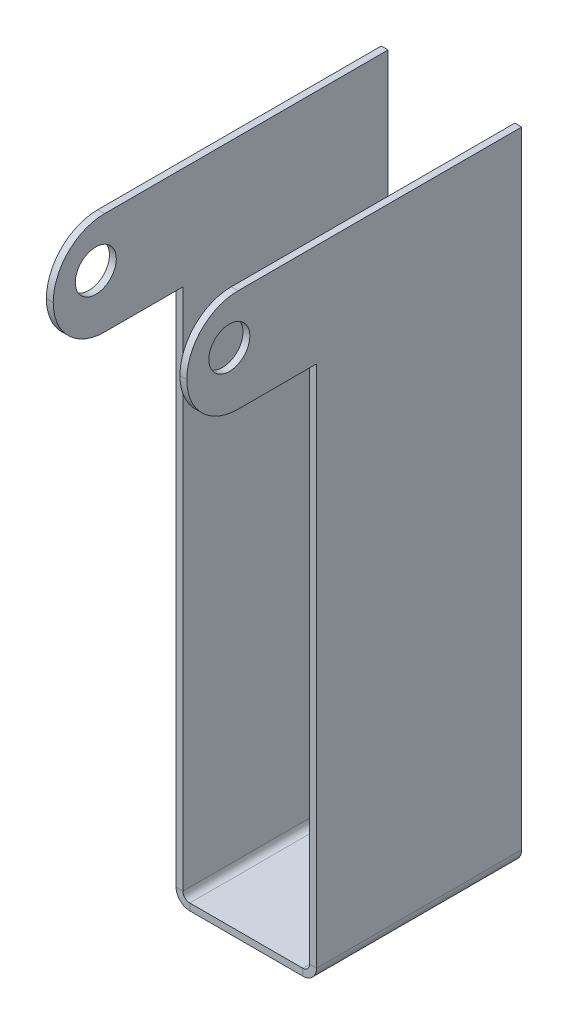
from build123d import *

# Parameters (mm, degrees)
SKETCH1_W                      = 18.53
SKETCH1_H                      = 1
BASE_FLANGE1_DEPTH             = 30
EDGE_FLANGE1_STRIP_W           = 6
EDGE_FLANGE1_STRIP_H           = 1
EDGE_FLANGE1_STRIP_CUT_DEPTH   = 30
EDGE_FLANGE1_STRIP_2_W         = 6
EDGE_FLANGE1_STRIP_2_H         = 1
EDGE_FLANGE1_STRIP_CUT_2_DEPTH = 30
EDGE_FLANGE1_DEPTH             = 30
EDGE_FLANGE1_BEND_DEPTH        = 30
SKETCH17_W                     = 18.97
SKETCH17_H                     = 15
TAB1_DEPTH                     = 1
SKETCH24_R                     = 3
CUT_EXTRUDE1_DEPTH             = 107.692049376
FILLET1_R                      = 7.5


# Sheet-metal steps are written as plain solids
with BuildPart() as part:
    # Sketch1 → Base-Flange1 (new body)
    with BuildSketch(Plane.XY):
        with Locations((9.265, -0.5)):
            Rectangle(SKETCH1_W, SKETCH1_H)
    extrude(amount=BASE_FLANGE1_DEPTH)

    # Edge-Flange1 strip (across the edge) → Edge-Flange1 strip cut (cut)
    with BuildSketch(Plane(origin=(18.53, 0, 30), x_dir=(-1, 0, 0), z_dir=(0, 0, -1))):
        with Locations((-2, -0.5)):
            Rectangle(EDGE_FLANGE1_STRIP_W, EDGE_FLANGE1_STRIP_H)
    extrude(amount=EDGE_FLANGE1_STRIP_CUT_DEPTH, mode=Mode.SUBTRACT)

    # Edge-Flange1 strip 2 (across the edge) → Edge-Flange1 strip cut 2 (cut)
    with BuildSketch(Plane.XY):
        with Locations((-2, -0.5)):
            Rectangle(EDGE_FLANGE1_STRIP_2_W, EDGE_FLANGE1_STRIP_2_H)
    extrude(amount=EDGE_FLANGE1_STRIP_CUT_2_DEPTH, mode=Mode.SUBTRACT)

    # Edge-Flange1 section (across the edge) → Edge-Flange1 (add)
    with BuildSketch(Plane(origin=(18.53, 0, 30), x_dir=(-1, 0, 0), z_dir=(0, 0, -1))):
        with BuildLine():
            Line((-1, 1), (-1, 92.54))
            Line((-1, 92.54), (0, 92.54))
            Line((0, 92.54), (0, 1))
            ThreePointArc((0, 1), (0.292893219, 0.292893219), (1, 0))
            Line((1, 0), (1, -1))
            ThreePointArc((1, -1), (-0.414213562, -0.414213562), (-1, 1))
        make_face()
    extrude(amount=EDGE_FLANGE1_DEPTH)

    # Edge-Flange1 section 2 (across the edge) → Edge-Flange1 bend (add)
    with BuildSketch(Plane.XY):
        with BuildLine():
            Line((-1, 1), (-1, 92.54))
            Line((-1, 92.54), (0, 92.54))
            Line((0, 92.54), (0, 1))
            ThreePointArc((0, 1), (0.292893219, 0.292893219), (1, 0))
            Line((1, 0), (1, -1))
            ThreePointArc((1, -1), (-0.414213562, -0.414213562), (-1, 1))
        make_face()
    extrude(amount=EDGE_FLANGE1_BEND_DEPTH)

    # Sketch17 → Tab1 (add)
    with BuildSketch(Plane(origin=(19.53, 0, 0), x_dir=(0, 0, -1), z_dir=(1, 0, 0))):
        with Locations((-39.485, 85.04)):
            Rectangle(SKETCH17_W, SKETCH17_H)
    tab1 = extrude(amount=-TAB1_DEPTH)

    # Mirror1: Tab1 across plane
    add(tab1.mirror(Plane(origin=(9.265, 0, 0), x_dir=(0, 0, 1), z_dir=(1, 0, 0))))

    # Sketch24 → Cut-Extrude1 (cut, through all)
    with BuildSketch(Plane(origin=(19.53, 0, 0), x_dir=(0, 0, -1), z_dir=(1, 0, 0))):
        with Locations(Location((-42.746376896, 85.96, 0), (0, 0, 90))):
            Circle(SKETCH24_R)
    extrude(amount=-CUT_EXTRUDE1_DEPTH, mode=Mode.SUBTRACT)

    # Fillet1
    fillet1_edges = [part.edges().sort_by_distance(p)[0] for p in [
        (19.03, 77.54, 48.97),
        (-0.5, 77.54, 48.97),
        (-0.5, 92.54, 48.97),
        (19.03, 92.54, 48.97),
    ]]
    fillet(fillet1_edges, radius=FILLET1_R - 0.0001)  # a hair under: the kernel refuses the full size


solid = part.part
